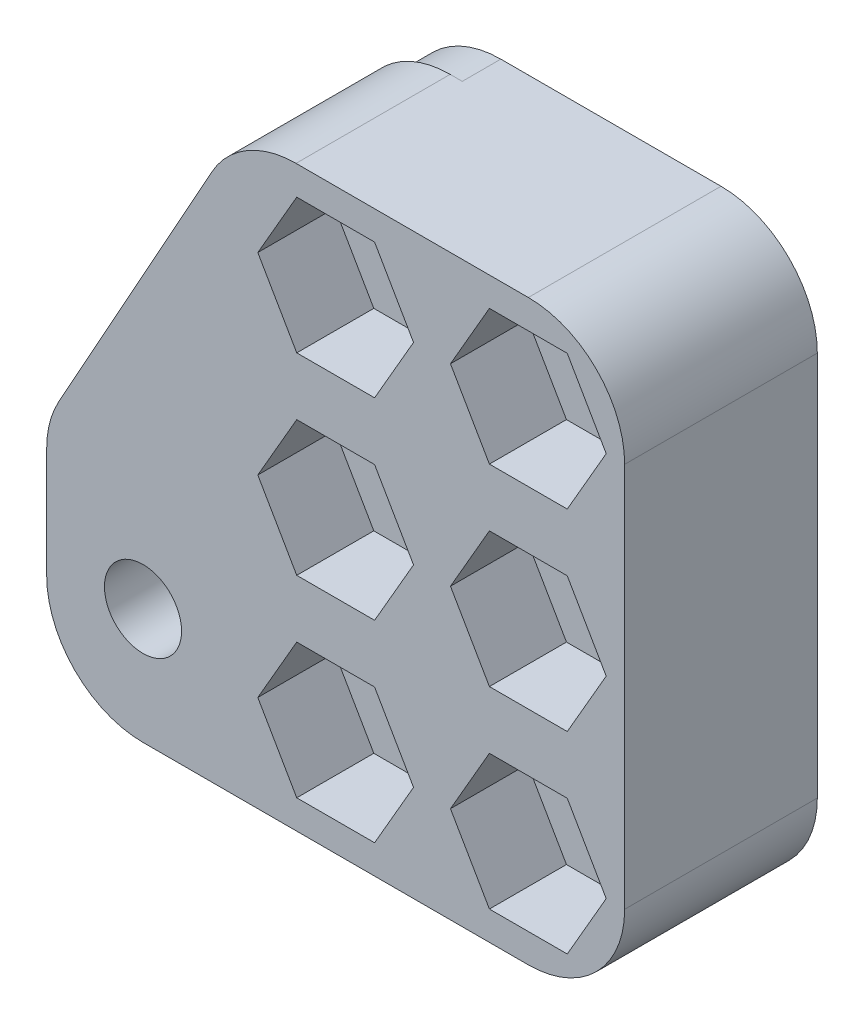
from build123d import *

# Parameters (mm, degrees)
SKETCH1_R           = 2.286
SKETCH1_R_2         = 2.54
BOSS_EXTRUDE1_DEPTH = 12.7
FILLET1_R           = 6.35
CUT_EXTRUDE1_DEPTH  = 5.08
CUT_EXTRUDE2_START  = -2.54
SKETCH3_R           = 2.54
CUT_EXTRUDE2_DEPTH  = 2.54
FILLET2_R           = 6.35


with BuildPart() as part:
    # Sketch1 → Boss-Extrude1 (new body)
    with BuildSketch(Plane.XY):
        Polygon((-6.35, 31.75), (-19.05, 8.89), (-19.05, -6.35), (-6.35, -6.35), (19.05, -6.35), (19.05, 31.75), align=None)
        Circle(SKETCH1_R, mode=Mode.SUBTRACT)
        with Locations((-12.7, 1.27)):
            Circle(SKETCH1_R_2, mode=Mode.SUBTRACT)
        with Locations((12.7, 0)):
            Circle(SKETCH1_R, mode=Mode.SUBTRACT)
        with Locations((12.7, 12.7)):
            Circle(SKETCH1_R, mode=Mode.SUBTRACT)
        with Locations((12.7, 25.4)):
            Circle(SKETCH1_R, mode=Mode.SUBTRACT)
        with Locations((0, 12.7)):
            Circle(SKETCH1_R, mode=Mode.SUBTRACT)
        with Locations((0, 25.4)):
            Circle(SKETCH1_R, mode=Mode.SUBTRACT)
    extrude(amount=BOSS_EXTRUDE1_DEPTH)

    # Fillet1
    fillet1_edges = [part.edges().sort_by_distance(p)[0] for p in [
        (-19.05, -6.35, 6.35),
        (-19.05, 8.89, 6.35),
        (-6.35, 31.75, 6.35),
        (19.05, 31.75, 6.35),
        (19.05, -6.35, 6.35),
    ]]
    fillet(fillet1_edges, radius=FILLET1_R)

    # Sketch2 → Cut-Extrude1 (cut)
    with BuildSketch(Plane.XY.offset(12.7)):
        Polygon((17.832643893, 0), (15.266321947, 4.445), (10.133678053, 4.445), (7.567356107, 0), (10.133678053, -4.445), (15.266321947, -4.445), align=None)
        Polygon((5.132643893, 0), (2.566321947, 4.445), (-2.566321947, 4.445), (-5.132643893, 0), (-2.566321947, -4.445), (2.566321947, -4.445), align=None)
        Polygon((17.832643893, 12.7), (15.266321947, 17.145), (10.133678053, 17.145), (7.567356107, 12.7), (10.133678053, 8.255), (15.266321947, 8.255), align=None)
        Polygon((17.832643893, 25.4), (15.266321947, 29.845), (10.133678053, 29.845), (7.567356107, 25.4), (10.133678053, 20.955), (15.266321947, 20.955), align=None)
        Polygon((5.132643893, 12.7), (2.566321947, 17.145), (-2.566321947, 17.145), (-5.132643893, 12.7), (-2.566321947, 8.255), (2.566321947, 8.255), align=None)
        Polygon((5.132643893, 25.4), (2.566321947, 29.845), (-2.566321947, 29.845), (-5.132643893, 25.4), (-2.566321947, 20.955), (2.566321947, 20.955), align=None)
    extrude(amount=-CUT_EXTRUDE1_DEPTH, mode=Mode.SUBTRACT)

    # Sketch3 → Cut-Extrude2 (cut)
    with BuildSketch(Plane(origin=(0, 0, 0), x_dir=(-1, 0, 0), z_dir=(0, 0, -1)).offset(CUT_EXTRUDE2_START)):
        with BuildLine():
            Line((18.250898703, 10.328382334), (8.164537437, 28.483832613))
            Line((8.164537437, 28.483832613), (8.164537437, -6.35))
            Line((8.164537437, -6.35), (12.7, -6.35))
            ThreePointArc((12.7, -6.35), (17.190128061, -4.490128061), (19.05, 0))
            Line((19.05, 0), (19.05, 7.244549721))
            ThreePointArc((19.05, 7.244549721), (18.846979208, 8.837392029), (18.250898703, 10.328382334))
        make_face()
        with Locations((12.7, 1.27)):
            Circle(SKETCH3_R, mode=Mode.SUBTRACT)
    extrude(amount=CUT_EXTRUDE2_DEPTH, mode=Mode.SUBTRACT)

    # Fillet2
    # the kernel refuses this fillet: 6.35 mm, written as the material it takes off along each edge
    with BuildSketch(Plane(origin=(-8.164537437, -6.35, 2.54), x_dir=(1, 0, 0), z_dir=(0, 0, -1))) as fillet2_piece_1:
        with BuildLine():
            CenterArc((FILLET2_R, -FILLET2_R), FILLET2_R, 90, 90)
            Line((0, -FILLET2_R), (0, 0))
            Line((0, 0), (FILLET2_R, 0))
        make_face()
    extrude(amount=18.415, mode=Mode.SUBTRACT)
    with BuildSketch(Plane(origin=(-8.164537437, 28.483832613, -17.851881799), x_dir=(0.8892619937285123, 0.45739819250844366, 0), z_dir=(0, 0, 1))) as fillet2_piece_2:
        with BuildLine():
            CenterArc((4.236274197, -5.64681366), FILLET2_R, 62.780655364, 90)
            Line((-1.410539463, -2.742335138), (-1.975220829, -2.451887286))
            Line((-1.975220829, -2.451887286), (-0.564681366, 0.290447852))
            Line((-0.564681366, 0.290447852), (-0.352566378, 0.528130617))
            ThreePointArc((-0.352566378, 0.528130617), (6.720590159, 0.930188855), (7.431200572, 0.564681366))
            Line((7.431200572, 0.564681366), (7.140752719, 0))
        make_face()
    extrude(amount=20.391881799, mode=Mode.SUBTRACT)


solid = part.part
